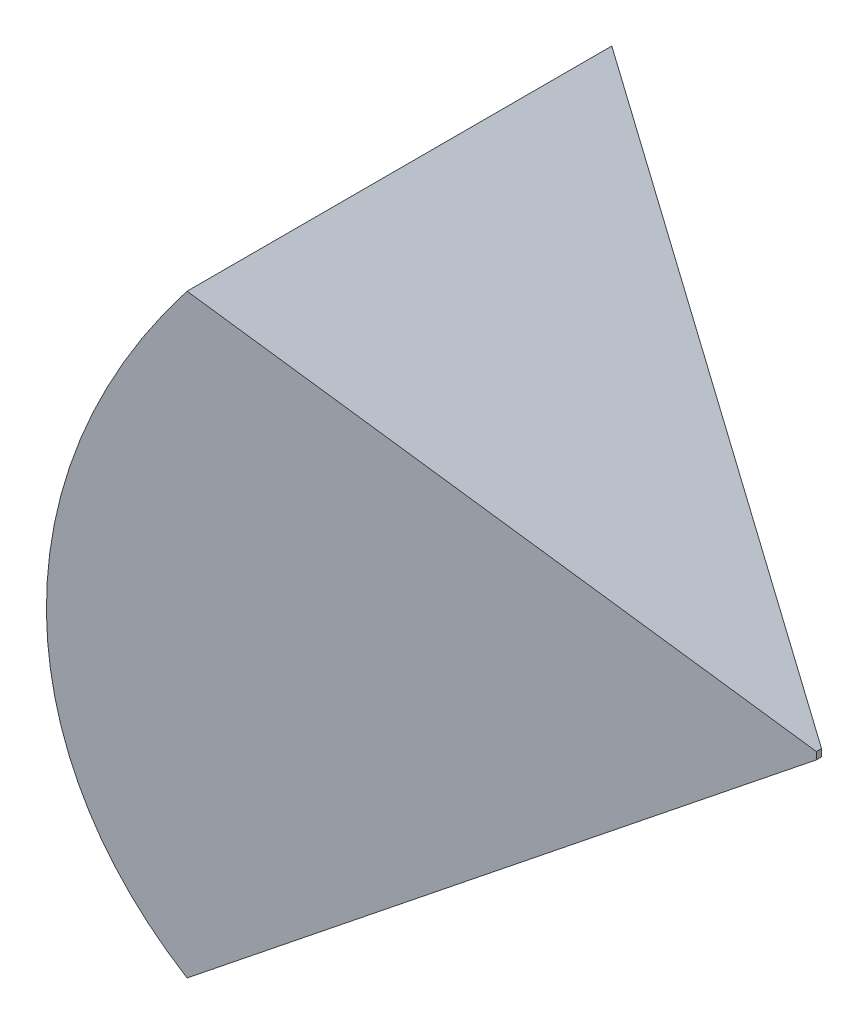
from build123d import *

# Parameters (mm, degrees)
BOSS_EXTRUDE1_DEPTH     = 20000
CUT_EXTRUDE1_DEPTH      = 30523.057128163
CUT_EXTRUDE1_DEPTH_BACK = 30523.057128163
CUT_EXTRUDE2_DEPTH      = 30523.057128163
CUT_EXTRUDE2_DEPTH_BACK = 30523.057128163
CUT_EXTRUDE3_DEPTH      = 30523.057128163
CUT_EXTRUDE3_DEPTH_BACK = 30523.057128163


with BuildPart() as part:
    # Sketch3 → Boss-Extrude1 (new body)
    with BuildSketch(Plane.XY):
        with BuildLine():
            Line((0, 0), (-16383.04088578, 11471.528727021))
            ThreePointArc((-16383.04088578, 11471.528727021), (-20000, 0), (-16383.04088578, -11471.528727021))
            Line((-16383.04088578, -11471.528727021), (0, 0))
        make_face()
    extrude(amount=BOSS_EXTRUDE1_DEPTH)

    # Sketch20 → Cut-Extrude1 (cut, two sides: drawn at the far end of the back side and taken through both)
    with BuildSketch(Plane(origin=(0, 0, 0), x_dir=(1, 0, 0), z_dir=(0, 1, 0)).offset(-CUT_EXTRUDE1_DEPTH_BACK)):
        Polygon((0, -10000), (-20000, -20000), (0, -20000), align=None)
    extrude(amount=CUT_EXTRUDE1_DEPTH + CUT_EXTRUDE1_DEPTH_BACK, mode=Mode.SUBTRACT)

    # Sketch22 → Cut-Extrude2 (cut, two sides: drawn at the far end of the back side and taken through both)
    with BuildSketch(Plane(origin=(0, 0, 0), x_dir=(1, 0, 0), z_dir=(0, 1, 0)).offset(-CUT_EXTRUDE2_DEPTH_BACK)):
        Polygon((0, -10000), (-20000, 0), (0, 0), align=None)
    extrude(amount=CUT_EXTRUDE2_DEPTH + CUT_EXTRUDE2_DEPTH_BACK, mode=Mode.SUBTRACT)

    # Sketch23 → Cut-Extrude3 (cut, two sides: drawn at the far end of the back side and taken through both)
    with BuildSketch(Plane(origin=(0, 0, 0), x_dir=(1, 0, 0), z_dir=(0, 1, 0)).offset(-CUT_EXTRUDE3_DEPTH_BACK)):
        Polygon((-200, -10100), (-200, -9900), (0, -10000), align=None)
    extrude(amount=CUT_EXTRUDE3_DEPTH + CUT_EXTRUDE3_DEPTH_BACK, mode=Mode.SUBTRACT)


solid = part.part
